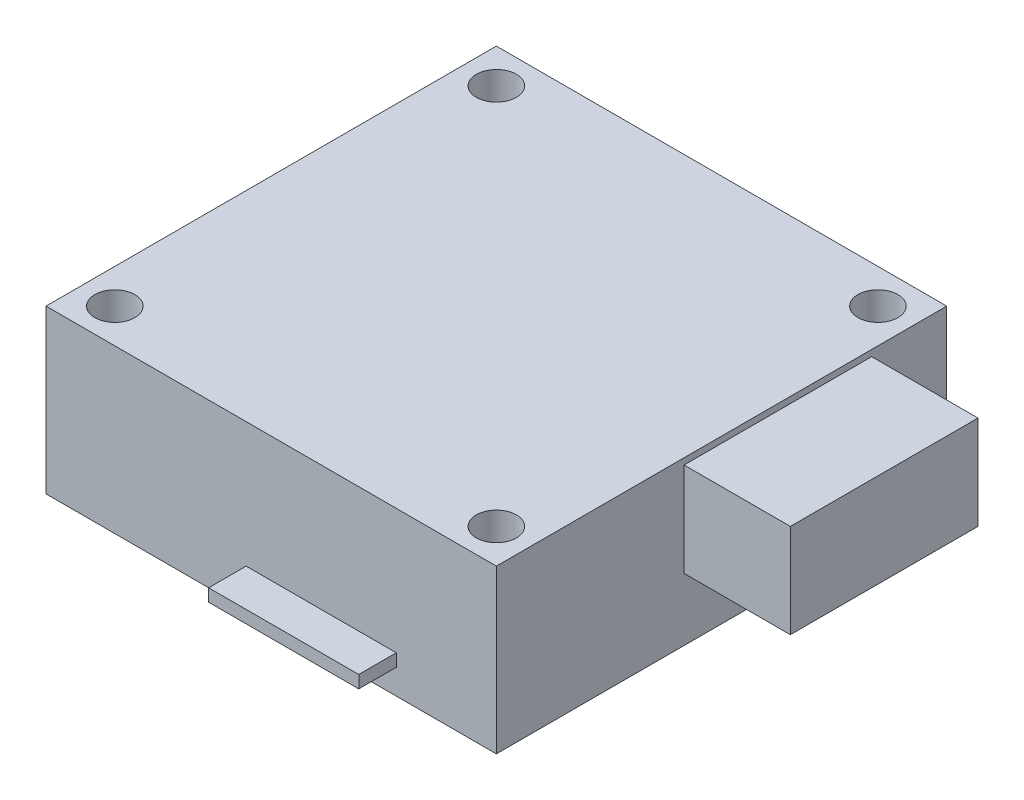
from build123d import *

# Parameters (mm, degrees)
SKETCH1_W           = 36
SKETCH1_H           = 36
SKETCH1_R           = 1.6
BOSS_EXTRUDE1_DEPTH = 13
SKETCH2_W           = 15
SKETCH2_H           = 7.5
BOSS_EXTRUDE2_DEPTH = 8.5
SKETCH3_W           = 12
SKETCH3_H           = 1
BOSS_EXTRUDE3_DEPTH = 3


with BuildPart() as part:
    # Sketch1 → Boss-Extrude1 (new body)
    with BuildSketch(Plane(origin=(0, 0, 0), x_dir=(1, 0, 0), z_dir=(0, 1, 0))):
        Rectangle(SKETCH1_W, SKETCH1_H)
        with Locations((-15.25, 15.25)):
            Circle(SKETCH1_R, mode=Mode.SUBTRACT)
        with Locations((15.25, 15.25)):
            Circle(SKETCH1_R, mode=Mode.SUBTRACT)
        with Locations((15.25, -15.25)):
            Circle(SKETCH1_R, mode=Mode.SUBTRACT)
        with Locations((-15.25, -15.25)):
            Circle(SKETCH1_R, mode=Mode.SUBTRACT)
    extrude(amount=BOSS_EXTRUDE1_DEPTH)

    # Sketch2 → Boss-Extrude2 (add)
    with BuildSketch(Plane(origin=(18, 0, 0), x_dir=(0, 0, -1), z_dir=(1, 0, 0))):
        with Locations((4.5, 8.75)):
            Rectangle(SKETCH2_W, SKETCH2_H)
    extrude(amount=BOSS_EXTRUDE2_DEPTH)

    # Sketch3 → Boss-Extrude3 (add)
    with BuildSketch(Plane.XY.offset(18)):
        with Locations((4, 2.5)):
            Rectangle(SKETCH3_W, SKETCH3_H)
    extrude(amount=BOSS_EXTRUDE3_DEPTH)


solid = part.part
